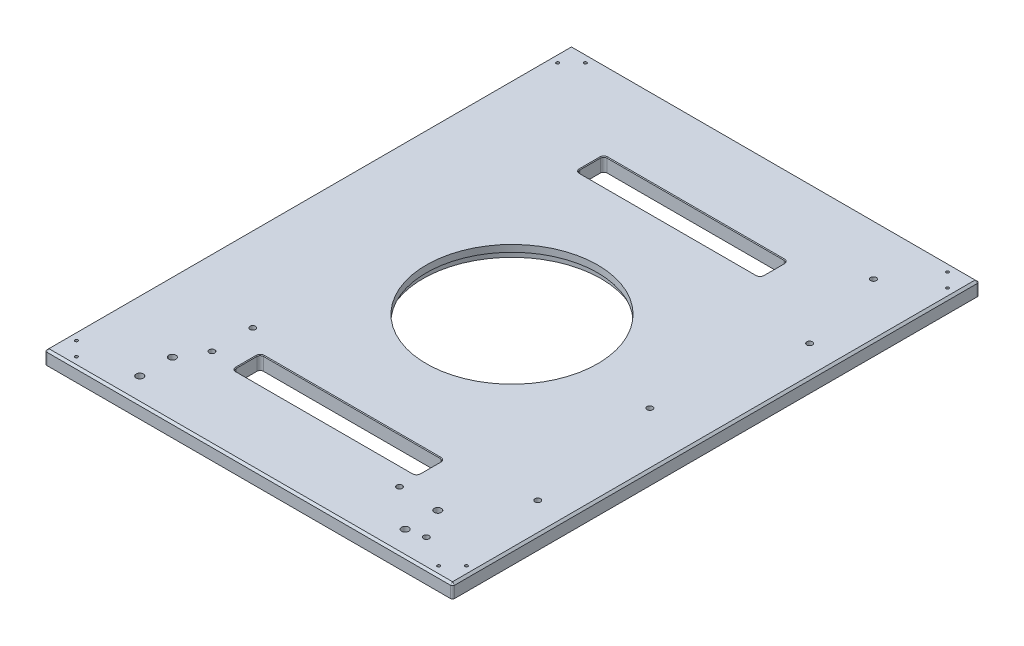
from build123d import *

# Parameters (mm, degrees)
SKETCH1_W                               = 600
SKETCH1_H                               = 775
MAINPLATE_DEPTH                         = 20
SKETCH2_R                               = 126
BUILDPLATE_DEPTH                        = 491.465340264
SKETCH3_R                               = 131
BUILDCYLINDERRELIEF_DEPTH               = 10
Z_AXISMOUNTHOLES_COUNT                  = 6
OVERFLOW_DEPTH                          = 491.465340264
M5_TAPPED_HOLE1_AT_2_COUNT              = 2
M5_TAPPED_HOLE1_AT_2_PITCH              = 120
M5_TAPPED_HOLE1_AT_3_COUNT              = 2
M5_TAPPED_HOLE1_AT_3_PITCH              = 60
M5_TAPPED_HOLE1_AT_4_COUNT              = 2
M5_TAPPED_HOLE1_AT_4_PITCH              = 151.634428808
M5_TAPPED_HOLE1_AT_5_COUNT              = 2
M5_TAPPED_HOLE1_AT_5_PITCH              = 148
CUT_EXTRUDE1_DEPTH                      = 491.465340264
M8_TAPPED_HOLE1_D                       = 6.8
M8_TAPPED_HOLE1_DEPTH                   = 12.957073895
M8_TAPPED_HOLE1_TIP                     = 2.042926105
M5_TAPPED_HOLE2_AT_2_COUNT              = 2
M5_TAPPED_HOLE2_AT_2_PITCH              = 28.991378029
CHAMFER1_SIZE                           = 1
FILLET1_R                               = 3
CHAMFER2_SIZE                           = 3
LPATTERN1_COUNT                         = 2
LPATTERN1_PITCH                         = 505.5
TAPPED_HOLE_FOR_M8X1_25_HELICOIL1_D     = 8.3
TAPPED_HOLE_FOR_M8X1_25_HELICOIL1_DEPTH = 10.506428431
TAPPED_HOLE_FOR_M8X1_25_HELICOIL1_TIP   = 2.493571569
TAPPED_HOLE_FOR_M10X1_5_HELICOIL1_D     = 10.5
TAPPED_HOLE_FOR_M10X1_5_HELICOIL1_DEPTH = 15.84548175
TAPPED_HOLE_FOR_M10X1_5_HELICOIL1_TIP   = 3.15451825
TAPPED_HOLE_FOR_M8X1_25_HELICOIL2_D     = 8.3
TAPPED_HOLE_FOR_M8X1_25_HELICOIL2_DEPTH = 17.006428431
TAPPED_HOLE_FOR_M8X1_25_HELICOIL2_TIP   = 2.493571569


with BuildPart() as part:
    # Sketch1 → MainPlate (new body)
    with BuildSketch(Plane(origin=(0, 0, 0), x_dir=(1, 0, 0), z_dir=(0, 1, 0))):
        Rectangle(SKETCH1_W, SKETCH1_H)
    extrude(amount=-MAINPLATE_DEPTH)

    # Sketch2 → BuildPlate (cut, through all)
    with BuildSketch(Plane(origin=(0, -20, 0), x_dir=(-1, 0, 0), z_dir=(0, -1, 0))):
        with Locations(Location((0, 0, 0), (0, 0, 90))):
            Circle(SKETCH2_R)
    extrude(amount=-BUILDPLATE_DEPTH, mode=Mode.SUBTRACT)

    # Sketch3 → BuildCylinderRelief (cut)
    with BuildSketch(Plane(origin=(0, -20, 0), x_dir=(-1, 0, 0), z_dir=(0, 1, 0))):
        with Locations(Location((0, 0, 0), (0, 0, 90))):
            Circle(SKETCH3_R)
    extrude(amount=BUILDCYLINDERRELIEF_DEPTH, mode=Mode.SUBTRACT)

    # Sketch5 → Z-axisHelicoils (revolve, cut)
    with BuildSketch(Plane(origin=(148.5, -20, 0), x_dir=(0, 0, -1), z_dir=(1, 0, 0))):
        Polygon((0, 0), (0, 19.643571569), (4.15, 17.15), (4.15, 0), align=None)
    z_axishelicoils = revolve(axis=Axis((148.5, -26.35, 0), (0, 1, 0)), mode=Mode.SUBTRACT)

    # Z-axisMountHoles: Z-axisHelicoils ×6 about axis
    z_axismountholes_axis = Axis((0, 0, 0), (0, 1, 0))
    for i in range(1, Z_AXISMOUNTHOLES_COUNT):
        add(z_axishelicoils.rotate(z_axismountholes_axis, i * 360 / Z_AXISMOUNTHOLES_COUNT), mode=Mode.SUBTRACT)

    # Sketch6 → Overflow (cut, through all)
    with BuildSketch(Plane(origin=(0, -20, 0), x_dir=(-1, 0, 0), z_dir=(0, -1, 0))):
        with BuildLine():
            Line((130, 230), (-130, 230))
            ThreePointArc((-130, 230), (-133.535533906, 231.464466094), (-135, 235))
            Line((-135, 235), (-135, 265))
            ThreePointArc((-135, 265), (-133.535533906, 268.535533906), (-130, 270))
            Line((-130, 270), (130, 270))
            ThreePointArc((130, 270), (133.535533906, 268.535533906), (135, 265))
            Line((135, 265), (135, 235))
            ThreePointArc((135, 235), (133.535533906, 231.464466094), (130, 230))
        make_face()
    extrude(amount=-OVERFLOW_DEPTH, mode=Mode.SUBTRACT)

    # Sketch8 → M5 Tapped Hole1 (revolve, cut)
    with BuildSketch(Plane(origin=(0, -20, -217), x_dir=(0, 0, -1), z_dir=(1, 0, 0))):
        Polygon((0, 0), (0, 13.6618073), (2.1, 12.4), (2.1, 0), align=None)
    m5_tapped_hole1 = revolve(axis=Axis((0, -26.35, -217), (0, 1, 0)), mode=Mode.SUBTRACT)

    # M5 Tapped Hole1 at 2: M5 Tapped Hole1 ×2
    with Locations(*[(i * M5_TAPPED_HOLE1_AT_2_PITCH, 0, 0) for i in range(1, M5_TAPPED_HOLE1_AT_2_COUNT)]):
        add(m5_tapped_hole1, mode=Mode.SUBTRACT)

    # M5 Tapped Hole1 at 3: M5 Tapped Hole1 ×2
    with Locations(*[(i * M5_TAPPED_HOLE1_AT_3_PITCH, 0, 0) for i in range(1, M5_TAPPED_HOLE1_AT_3_COUNT)]):
        add(m5_tapped_hole1, mode=Mode.SUBTRACT)

    # M5 Tapped Hole1 at 4: M5 Tapped Hole1 ×2
    with Locations(*[Vector(0.9760316384821002, 0, -0.21762867614803644) * (i * M5_TAPPED_HOLE1_AT_4_PITCH) for i in range(1, M5_TAPPED_HOLE1_AT_4_COUNT)]):
        add(m5_tapped_hole1, mode=Mode.SUBTRACT)

    # M5 Tapped Hole1 at 5: M5 Tapped Hole1 ×2
    with Locations(*[(i * M5_TAPPED_HOLE1_AT_5_PITCH, 0, 0) for i in range(1, M5_TAPPED_HOLE1_AT_5_COUNT)]):
        add(m5_tapped_hole1, mode=Mode.SUBTRACT)

    # Mirror3: M5 Tapped Hole1 across plane
    add(m5_tapped_hole1.mirror(Plane(origin=(0, 0, 0), x_dir=(0, 0, 1), z_dir=(1, 0, 0))), mode=Mode.SUBTRACT)

    # Mirror3 copy 1 sketch → Mirror3 copy 1 (revolve, cut)
    with BuildSketch(Plane(origin=(-120, -20, -217), x_dir=(0, 0, -1), z_dir=(-1, 0, 0))):
        Polygon((0, 0), (0, -13.6618073), (2.1, -12.4), (2.1, 0), align=None)
    revolve(axis=Axis((-120, -26.35, -217), (0, -1, 0)), mode=Mode.SUBTRACT)

    # Mirror3 copy 2 sketch → Mirror3 copy 2 (revolve, cut)
    with BuildSketch(Plane(origin=(-60, -20, -217), x_dir=(0, 0, -1), z_dir=(-1, 0, 0))):
        Polygon((0, 0), (0, -13.6618073), (2.1, -12.4), (2.1, 0), align=None)
    revolve(axis=Axis((-60, -26.35, -217), (0, -1, 0)), mode=Mode.SUBTRACT)

    # Mirror3 copy 3 sketch → Mirror3 copy 3 (revolve, cut)
    with BuildSketch(Plane(origin=(-148, -20, -250), x_dir=(0, 0, -1), z_dir=(-1, 0, 0))):
        Polygon((0, 0), (0, -13.6618073), (2.1, -12.4), (2.1, 0), align=None)
    revolve(axis=Axis((-148, -26.35, -250), (0, -1, 0)), mode=Mode.SUBTRACT)

    # Mirror3 copy 4 sketch → Mirror3 copy 4 (revolve, cut)
    with BuildSketch(Plane(origin=(-148, -20, -217), x_dir=(0, 0, -1), z_dir=(-1, 0, 0))):
        Polygon((0, 0), (0, -13.6618073), (2.1, -12.4), (2.1, 0), align=None)
    revolve(axis=Axis((-148, -26.35, -217), (0, -1, 0)), mode=Mode.SUBTRACT)

    # Mirror4: M5 Tapped Hole1 across plane
    add(m5_tapped_hole1.mirror(Plane.XY.offset(-250)), mode=Mode.SUBTRACT)

    # Mirror4 copy 1 sketch → Mirror4 copy 1 (revolve, cut)
    with BuildSketch(Plane(origin=(120, -20, -283), x_dir=(0, 0, 1), z_dir=(1, 0, 0))):
        Polygon((0, 0), (0, -13.6618073), (2.1, -12.4), (2.1, 0), align=None)
    revolve(axis=Axis((120, -26.35, -283), (0, -1, 0)), mode=Mode.SUBTRACT)

    # Mirror4 copy 2 sketch → Mirror4 copy 2 (revolve, cut)
    with BuildSketch(Plane(origin=(60, -20, -283), x_dir=(0, 0, 1), z_dir=(1, 0, 0))):
        Polygon((0, 0), (0, -13.6618073), (2.1, -12.4), (2.1, 0), align=None)
    revolve(axis=Axis((60, -26.35, -283), (0, -1, 0)), mode=Mode.SUBTRACT)

    # Mirror4 copy 3 sketch → Mirror4 copy 3 (revolve, cut)
    with BuildSketch(Plane(origin=(148, -20, -250), x_dir=(0, 0, 1), z_dir=(1, 0, 0))):
        Polygon((0, 0), (0, -13.6618073), (2.1, -12.4), (2.1, 0), align=None)
    revolve(axis=Axis((148, -26.35, -250), (0, -1, 0)), mode=Mode.SUBTRACT)

    # Mirror4 copy 4 sketch → Mirror4 copy 4 (revolve, cut)
    with BuildSketch(Plane(origin=(148, -20, -283), x_dir=(0, 0, 1), z_dir=(1, 0, 0))):
        Polygon((0, 0), (0, -13.6618073), (2.1, -12.4), (2.1, 0), align=None)
    revolve(axis=Axis((148, -26.35, -283), (0, -1, 0)), mode=Mode.SUBTRACT)

    # Mirror4 copy 5 sketch → Mirror4 copy 5 (revolve, cut)
    with BuildSketch(Plane(origin=(0, -20, -283), x_dir=(0, 0, 1), z_dir=(-1, 0, 0))):
        Polygon((0, 0), (0, 13.6618073), (2.1, 12.4), (2.1, 0), align=None)
    revolve(axis=Axis((0, -26.35, -283), (0, 1, 0)), mode=Mode.SUBTRACT)

    # Mirror4 copy 6 sketch → Mirror4 copy 6 (revolve, cut)
    with BuildSketch(Plane(origin=(-120, -20, -283), x_dir=(0, 0, 1), z_dir=(-1, 0, 0))):
        Polygon((0, 0), (0, 13.6618073), (2.1, 12.4), (2.1, 0), align=None)
    revolve(axis=Axis((-120, -26.35, -283), (0, 1, 0)), mode=Mode.SUBTRACT)

    # Mirror4 copy 7 sketch → Mirror4 copy 7 (revolve, cut)
    with BuildSketch(Plane(origin=(-60, -20, -283), x_dir=(0, 0, 1), z_dir=(-1, 0, 0))):
        Polygon((0, 0), (0, 13.6618073), (2.1, 12.4), (2.1, 0), align=None)
    revolve(axis=Axis((-60, -26.35, -283), (0, 1, 0)), mode=Mode.SUBTRACT)

    # Mirror4 copy 8 sketch → Mirror4 copy 8 (revolve, cut)
    with BuildSketch(Plane(origin=(-148, -20, -250), x_dir=(0, 0, 1), z_dir=(-1, 0, 0))):
        Polygon((0, 0), (0, 13.6618073), (2.1, 12.4), (2.1, 0), align=None)
    revolve(axis=Axis((-148, -26.35, -250), (0, 1, 0)), mode=Mode.SUBTRACT)

    # Mirror4 copy 9 sketch → Mirror4 copy 9 (revolve, cut)
    with BuildSketch(Plane(origin=(-148, -20, -283), x_dir=(0, 0, 1), z_dir=(-1, 0, 0))):
        Polygon((0, 0), (0, 13.6618073), (2.1, 12.4), (2.1, 0), align=None)
    revolve(axis=Axis((-148, -26.35, -283), (0, 1, 0)), mode=Mode.SUBTRACT)

    # Sketch10 → Cut-Extrude1 (cut, through all)
    with BuildSketch(Plane(origin=(0, 0, 0), x_dir=(1, 0, 0), z_dir=(0, 1, 0))):
        with BuildLine():
            Line((-130, -275.5), (130, -275.5))
            ThreePointArc((130, -275.5), (133.535533906, -274.035533906), (135, -270.5))
            Line((135, -270.5), (135, -240.5))
            ThreePointArc((135, -240.5), (133.535533906, -236.964466094), (130, -235.5))
            Line((130, -235.5), (-130, -235.5))
            ThreePointArc((-130, -235.5), (-133.535533906, -236.964466094), (-135, -240.5))
            Line((-135, -240.5), (-135, -270.5))
            ThreePointArc((-135, -270.5), (-133.535533906, -274.035533906), (-130, -275.5))
        make_face()
    extrude(amount=-CUT_EXTRUDE1_DEPTH, mode=Mode.SUBTRACT)

    # M8 Tapped Hole1
    with Locations(Plane(origin=(0, -20, 0), x_dir=(-1, 0, 0), z_dir=(0, -1, 0))):
        with Locations((-240, 150), (-110, 327.5), (-240, -150), (-110, -327.5), (110, -327.5), (240, -150), (240, 150), (110, 327.5)):
            Hole(M8_TAPPED_HOLE1_D / 2, depth=M8_TAPPED_HOLE1_DEPTH)
            with Locations((0, 0, -(M8_TAPPED_HOLE1_DEPTH + M8_TAPPED_HOLE1_TIP / 2))):  # 118° drill point
                Cone(0, M8_TAPPED_HOLE1_D / 2, M8_TAPPED_HOLE1_TIP, mode=Mode.SUBTRACT)

    # Sketch16 → M5 Tapped Hole2 (revolve, cut)
    with BuildSketch(Plane(origin=(266.5, 0, -374.5), x_dir=(0, 0, 1), z_dir=(1, 0, 0))):
        Polygon((0, 0), (0, 12.4), (2.1, 11.1381927), (2.1, 0), align=None)
    m5_tapped_hole2 = revolve(axis=Axis((266.5, 6.35, -374.5), (0, -1, 0)), mode=Mode.SUBTRACT)

    # M5 Tapped Hole2 at 2: M5 Tapped Hole2 ×2
    with Locations(*[Vector(0.7071067811865476, 0, 0.7071067811865476) * (i * M5_TAPPED_HOLE2_AT_2_PITCH) for i in range(1, M5_TAPPED_HOLE2_AT_2_COUNT)]):
        add(m5_tapped_hole2, mode=Mode.SUBTRACT)

    # Mirror1: M5 Tapped Hole2 across plane
    add(m5_tapped_hole2.mirror(Plane(origin=(0, 0, 0), x_dir=(0, 0, 1), z_dir=(1, 0, 0))), mode=Mode.SUBTRACT)

    # Mirror1 copy 1 sketch → Mirror1 copy 1 (revolve, cut)
    with BuildSketch(Plane(origin=(-287, 0, -354), x_dir=(0, 0, 1), z_dir=(-1, 0, 0))):
        Polygon((0, 0), (0, -12.4), (2.1, -11.1381927), (2.1, 0), align=None)
    revolve(axis=Axis((-287, 6.35, -354), (0, 1, 0)), mode=Mode.SUBTRACT)

    # Mirror2: M5 Tapped Hole2 across plane
    add(m5_tapped_hole2.mirror(Plane.XY), mode=Mode.SUBTRACT)

    # Mirror2 copy 1 sketch → Mirror2 copy 1 (revolve, cut)
    with BuildSketch(Plane(origin=(287, 0, 354), x_dir=(0, 0, -1), z_dir=(1, 0, 0))):
        Polygon((0, 0), (0, -12.4), (2.1, -11.1381927), (2.1, 0), align=None)
    revolve(axis=Axis((287, 6.35, 354), (0, 1, 0)), mode=Mode.SUBTRACT)

    # Mirror2 copy 2 sketch → Mirror2 copy 2 (revolve, cut)
    with BuildSketch(Plane(origin=(-266.5, 0, 374.5), x_dir=(0, 0, -1), z_dir=(-1, 0, 0))):
        Polygon((0, 0), (0, 12.4), (2.1, 11.1381927), (2.1, 0), align=None)
    revolve(axis=Axis((-266.5, 6.35, 374.5), (0, -1, 0)), mode=Mode.SUBTRACT)

    # Mirror2 copy 3 sketch → Mirror2 copy 3 (revolve, cut)
    with BuildSketch(Plane(origin=(-287, 0, 354), x_dir=(0, 0, -1), z_dir=(-1, 0, 0))):
        Polygon((0, 0), (0, 12.4), (2.1, 11.1381927), (2.1, 0), align=None)
    revolve(axis=Axis((-287, 6.35, 354), (0, -1, 0)), mode=Mode.SUBTRACT)

    # Chamfer1
    chamfer1_edges = [part.edges().sort_by_distance(p)[0] for p in [
        (-133.535533906, 0, -231.464466094),
        (0, 0, -230),
        (133.535533906, 0, -231.464466094),
        (135, 0, -250),
        (133.535533906, 0, -268.535533906),
        (0, 0, -270),
        (133.535533906, 0, 274.035533906),
        (135, 0, 255.5),
        (133.535533906, 0, 236.964466094),
        (0, 0, 235.5),
        (-133.535533906, 0, 236.964466094),
        (-135, 0, 255.5),
        (-133.535533906, 0, 274.035533906),
        (0, 0, 275.5),
        (-133.535533906, 0, -268.535533906),
        (-135, 0, -250),
    ]]
    chamfer(chamfer1_edges, length=CHAMFER1_SIZE)

    # Fillet1
    fillet1_edges = [part.edges().sort_by_distance(p)[0] for p in [
        (300, -10, 387.5),
        (-300, -10, 387.5),
        (-300, -10, -387.5),
        (300, -10, -387.5),
    ]]
    fillet(fillet1_edges, radius=FILLET1_R)

    # Chamfer2
    chamfer2_edges = [part.edges().sort_by_distance(p)[0] for p in [
        (0, 0, -387.5),
        (300, 0, 0),
        (-300, 0, 0),
        (0, 0, 387.5),
        (299.121320344, 0, -386.621320344),
        (299.121320344, 0, 386.621320344),
        (-299.121320344, 0, 386.621320344),
        (-299.121320344, 0, -386.621320344),
    ]]
    chamfer(chamfer2_edges, length=CHAMFER2_SIZE - 0.0001)  # a hair under: the kernel refuses the full size

    # LPattern1: M5 Tapped Hole1 ×2
    with Locations(*[(0, 0, i * LPATTERN1_PITCH) for i in range(1, LPATTERN1_COUNT)]):
        add(m5_tapped_hole1, mode=Mode.SUBTRACT)

    # LPattern1 copy 1 sketch → LPattern1 copy 1 (revolve, cut)
    with BuildSketch(Plane(origin=(120, -20, 288.5), x_dir=(0, 0, -1), z_dir=(1, 0, 0))):
        Polygon((0, 0), (0, 13.6618073), (2.1, 12.4), (2.1, 0), align=None)
    revolve(axis=Axis((120, -26.35, 288.5), (0, 1, 0)), mode=Mode.SUBTRACT)

    # LPattern1 copy 2 sketch → LPattern1 copy 2 (revolve, cut)
    with BuildSketch(Plane(origin=(60, -20, 288.5), x_dir=(0, 0, -1), z_dir=(1, 0, 0))):
        Polygon((0, 0), (0, 13.6618073), (2.1, 12.4), (2.1, 0), align=None)
    revolve(axis=Axis((60, -26.35, 288.5), (0, 1, 0)), mode=Mode.SUBTRACT)

    # LPattern1 copy 3 sketch → LPattern1 copy 3 (revolve, cut)
    with BuildSketch(Plane(origin=(148, -20, 255.5), x_dir=(0, 0, -1), z_dir=(1, 0, 0))):
        Polygon((0, 0), (0, 13.6618073), (2.1, 12.4), (2.1, 0), align=None)
    revolve(axis=Axis((148, -26.35, 255.5), (0, 1, 0)), mode=Mode.SUBTRACT)

    # LPattern1 copy 4 sketch → LPattern1 copy 4 (revolve, cut)
    with BuildSketch(Plane(origin=(148, -20, 288.5), x_dir=(0, 0, -1), z_dir=(1, 0, 0))):
        Polygon((0, 0), (0, 13.6618073), (2.1, 12.4), (2.1, 0), align=None)
    revolve(axis=Axis((148, -26.35, 288.5), (0, 1, 0)), mode=Mode.SUBTRACT)

    # LPattern1 copy 5 sketch → LPattern1 copy 5 (revolve, cut)
    with BuildSketch(Plane(origin=(0, -20, 288.5), x_dir=(0, 0, -1), z_dir=(-1, 0, 0))):
        Polygon((0, 0), (0, -13.6618073), (2.1, -12.4), (2.1, 0), align=None)
    revolve(axis=Axis((0, -26.35, 288.5), (0, -1, 0)), mode=Mode.SUBTRACT)

    # LPattern1 copy 6 sketch → LPattern1 copy 6 (revolve, cut)
    with BuildSketch(Plane(origin=(-120, -20, 288.5), x_dir=(0, 0, -1), z_dir=(-1, 0, 0))):
        Polygon((0, 0), (0, -13.6618073), (2.1, -12.4), (2.1, 0), align=None)
    revolve(axis=Axis((-120, -26.35, 288.5), (0, -1, 0)), mode=Mode.SUBTRACT)

    # LPattern1 copy 7 sketch → LPattern1 copy 7 (revolve, cut)
    with BuildSketch(Plane(origin=(-60, -20, 288.5), x_dir=(0, 0, -1), z_dir=(-1, 0, 0))):
        Polygon((0, 0), (0, -13.6618073), (2.1, -12.4), (2.1, 0), align=None)
    revolve(axis=Axis((-60, -26.35, 288.5), (0, -1, 0)), mode=Mode.SUBTRACT)

    # LPattern1 copy 8 sketch → LPattern1 copy 8 (revolve, cut)
    with BuildSketch(Plane(origin=(-148, -20, 255.5), x_dir=(0, 0, -1), z_dir=(-1, 0, 0))):
        Polygon((0, 0), (0, -13.6618073), (2.1, -12.4), (2.1, 0), align=None)
    revolve(axis=Axis((-148, -26.35, 255.5), (0, -1, 0)), mode=Mode.SUBTRACT)

    # LPattern1 copy 9 sketch → LPattern1 copy 9 (revolve, cut)
    with BuildSketch(Plane(origin=(-148, -20, 288.5), x_dir=(0, 0, -1), z_dir=(-1, 0, 0))):
        Polygon((0, 0), (0, -13.6618073), (2.1, -12.4), (2.1, 0), align=None)
    revolve(axis=Axis((-148, -26.35, 288.5), (0, -1, 0)), mode=Mode.SUBTRACT)

    # LPattern1 copy 10 sketch → LPattern1 copy 10 (revolve, cut)
    with BuildSketch(Plane(origin=(0, -20, 222.5), x_dir=(0, 0, 1), z_dir=(1, 0, 0))):
        Polygon((0, 0), (0, -13.6618073), (2.1, -12.4), (2.1, 0), align=None)
    revolve(axis=Axis((0, -26.35, 222.5), (0, -1, 0)), mode=Mode.SUBTRACT)

    # LPattern1 copy 11 sketch → LPattern1 copy 11 (revolve, cut)
    with BuildSketch(Plane(origin=(120, -20, 222.5), x_dir=(0, 0, 1), z_dir=(1, 0, 0))):
        Polygon((0, 0), (0, -13.6618073), (2.1, -12.4), (2.1, 0), align=None)
    revolve(axis=Axis((120, -26.35, 222.5), (0, -1, 0)), mode=Mode.SUBTRACT)

    # LPattern1 copy 12 sketch → LPattern1 copy 12 (revolve, cut)
    with BuildSketch(Plane(origin=(60, -20, 222.5), x_dir=(0, 0, 1), z_dir=(1, 0, 0))):
        Polygon((0, 0), (0, -13.6618073), (2.1, -12.4), (2.1, 0), align=None)
    revolve(axis=Axis((60, -26.35, 222.5), (0, -1, 0)), mode=Mode.SUBTRACT)

    # LPattern1 copy 13 sketch → LPattern1 copy 13 (revolve, cut)
    with BuildSketch(Plane(origin=(148, -20, 255.5), x_dir=(0, 0, 1), z_dir=(1, 0, 0))):
        Polygon((0, 0), (0, -13.6618073), (2.1, -12.4), (2.1, 0), align=None)
    revolve(axis=Axis((148, -26.35, 255.5), (0, -1, 0)), mode=Mode.SUBTRACT)

    # LPattern1 copy 14 sketch → LPattern1 copy 14 (revolve, cut)
    with BuildSketch(Plane(origin=(148, -20, 222.5), x_dir=(0, 0, 1), z_dir=(1, 0, 0))):
        Polygon((0, 0), (0, -13.6618073), (2.1, -12.4), (2.1, 0), align=None)
    revolve(axis=Axis((148, -26.35, 222.5), (0, -1, 0)), mode=Mode.SUBTRACT)

    # LPattern1 copy 15 sketch → LPattern1 copy 15 (revolve, cut)
    with BuildSketch(Plane(origin=(0, -20, 222.5), x_dir=(0, 0, 1), z_dir=(-1, 0, 0))):
        Polygon((0, 0), (0, 13.6618073), (2.1, 12.4), (2.1, 0), align=None)
    revolve(axis=Axis((0, -26.35, 222.5), (0, 1, 0)), mode=Mode.SUBTRACT)

    # LPattern1 copy 16 sketch → LPattern1 copy 16 (revolve, cut)
    with BuildSketch(Plane(origin=(-120, -20, 222.5), x_dir=(0, 0, 1), z_dir=(-1, 0, 0))):
        Polygon((0, 0), (0, 13.6618073), (2.1, 12.4), (2.1, 0), align=None)
    revolve(axis=Axis((-120, -26.35, 222.5), (0, 1, 0)), mode=Mode.SUBTRACT)

    # LPattern1 copy 17 sketch → LPattern1 copy 17 (revolve, cut)
    with BuildSketch(Plane(origin=(-60, -20, 222.5), x_dir=(0, 0, 1), z_dir=(-1, 0, 0))):
        Polygon((0, 0), (0, 13.6618073), (2.1, 12.4), (2.1, 0), align=None)
    revolve(axis=Axis((-60, -26.35, 222.5), (0, 1, 0)), mode=Mode.SUBTRACT)

    # LPattern1 copy 18 sketch → LPattern1 copy 18 (revolve, cut)
    with BuildSketch(Plane(origin=(-148, -20, 255.5), x_dir=(0, 0, 1), z_dir=(-1, 0, 0))):
        Polygon((0, 0), (0, 13.6618073), (2.1, 12.4), (2.1, 0), align=None)
    revolve(axis=Axis((-148, -26.35, 255.5), (0, 1, 0)), mode=Mode.SUBTRACT)

    # LPattern1 copy 19 sketch → LPattern1 copy 19 (revolve, cut)
    with BuildSketch(Plane(origin=(-148, -20, 222.5), x_dir=(0, 0, 1), z_dir=(-1, 0, 0))):
        Polygon((0, 0), (0, 13.6618073), (2.1, 12.4), (2.1, 0), align=None)
    revolve(axis=Axis((-148, -26.35, 222.5), (0, 1, 0)), mode=Mode.SUBTRACT)

    # Tapped Hole for M8x1.25 Helicoil1
    with Locations(Plane(origin=(0, 0, 0), x_dir=(1, 0, 0), z_dir=(0, 1, 0))):
        with Locations((221, 310.9), (256, 181.9), (221, -18.1), (256, -218.1), (221, -347.1)):
            Hole(TAPPED_HOLE_FOR_M8X1_25_HELICOIL1_D / 2, depth=TAPPED_HOLE_FOR_M8X1_25_HELICOIL1_DEPTH)
            with Locations((0, 0, -(TAPPED_HOLE_FOR_M8X1_25_HELICOIL1_DEPTH + TAPPED_HOLE_FOR_M8X1_25_HELICOIL1_TIP / 2))):  # 118° drill point
                Cone(0, TAPPED_HOLE_FOR_M8X1_25_HELICOIL1_D / 2, TAPPED_HOLE_FOR_M8X1_25_HELICOIL1_TIP, mode=Mode.SUBTRACT)

    # Tapped Hole for M10x1.5 Helicoil1
    with Locations(Plane(origin=(0, 0, 0), x_dir=(1, 0, 0), z_dir=(0, 1, 0))):
        with Locations((-195.25000001, -304.5), (-195.25000001, -352.5), (195.25000001, -304.5), (195.25000001, -352.5)):
            Hole(TAPPED_HOLE_FOR_M10X1_5_HELICOIL1_D / 2, depth=TAPPED_HOLE_FOR_M10X1_5_HELICOIL1_DEPTH)
            with Locations((0, 0, -(TAPPED_HOLE_FOR_M10X1_5_HELICOIL1_DEPTH + TAPPED_HOLE_FOR_M10X1_5_HELICOIL1_TIP / 2))):  # 118° drill point
                Cone(0, TAPPED_HOLE_FOR_M10X1_5_HELICOIL1_D / 2, TAPPED_HOLE_FOR_M10X1_5_HELICOIL1_TIP, mode=Mode.SUBTRACT)

    # Tapped Hole for M8x1.25 Helicoil2
    with Locations(Plane(origin=(0, 0, 0), x_dir=(1, 0, 0), z_dir=(0, 1, 0))):
        with Locations((-173.5, -208), (-173.5, -268), (137, -302.5)):
            Hole(TAPPED_HOLE_FOR_M8X1_25_HELICOIL2_D / 2, depth=TAPPED_HOLE_FOR_M8X1_25_HELICOIL2_DEPTH)
            with Locations((0, 0, -(TAPPED_HOLE_FOR_M8X1_25_HELICOIL2_DEPTH + TAPPED_HOLE_FOR_M8X1_25_HELICOIL2_TIP / 2))):  # 118° drill point
                Cone(0, TAPPED_HOLE_FOR_M8X1_25_HELICOIL2_D / 2, TAPPED_HOLE_FOR_M8X1_25_HELICOIL2_TIP, mode=Mode.SUBTRACT)


solid = part.part
